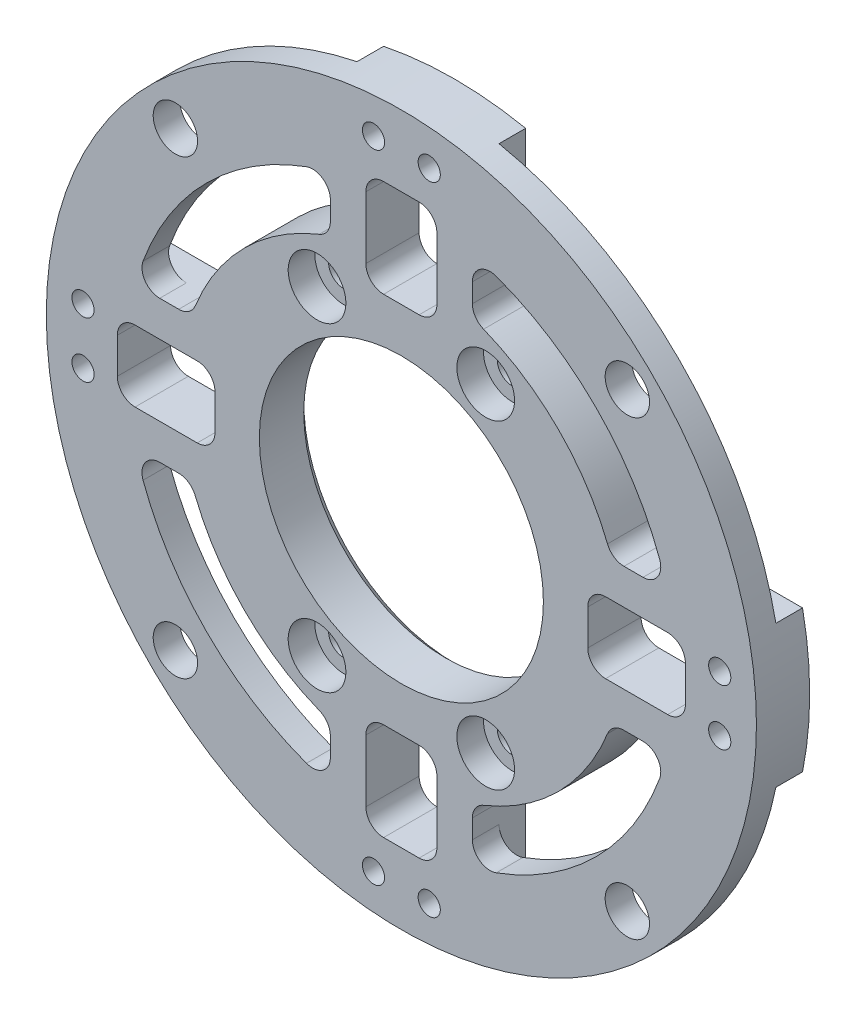
from build123d import *

# Parameters (mm, degrees)
SKETCH2_R             = 40
SKETCH2_R_2           = 16
BOSS_EXTRUDE1_DEPTH   = 6
CUT_EXTRUDE1_DEPTH    = 3
M3X0_5_TAPPED_HOLE1_D = 2.5
CIRPATTERN1_COUNT     = 4
CHAMFER1_SIZE         = 1
HOLE1_D               = 3.4
HOLE1_CBORE_D         = 6.5
HOLE1_CBORE_DEPTH     = 3
CUT_EXTRUDE2_DEPTH    = 57.648036153
SKETCH11_W            = 8
SKETCH11_H            = 11
CUT_EXTRUDE3_DEPTH    = 57.885850613
FILLET1_R             = 2
FILLET2_R             = 2
CIRPATTERN2_DEPTH     = 6
M4_CLEARANCE_HOLE1_D  = 5
CIRPATTERN3_COUNT     = 4
FILLET3_R             = 2


# Read off the part's stored shape, not the designer's step: CirPattern2
with BuildPart() as part:
    # Sketch2 → Boss-Extrude1 (new body)
    with BuildSketch(Plane.XY):
        Circle(SKETCH2_R)
        Circle(SKETCH2_R_2, mode=Mode.SUBTRACT)
    extrude(amount=BOSS_EXTRUDE1_DEPTH)

    # Sketch3 → Cut-Extrude1 (cut)
    with BuildSketch(Plane(origin=(0, 0, 0), x_dir=(-1, 0, 0), z_dir=(0, 0, -1))):
        with BuildLine():
            Line((-8, 23.685438565), (-8, 41.112910233))
            ThreePointArc((-8, 41.112910233), (-29.61647673, 29.61647673), (-41.112910233, 8))
            Line((-41.112910233, 8), (-23.685438565, 8))
            ThreePointArc((-23.685438565, 8), (-17.67766953, 17.67766953), (-8, 23.685438565))
        make_face()
        with BuildLine():
            ThreePointArc((41.112910233, 8), (29.61647673, 29.61647673), (8, 41.112910233))
            Line((8, 41.112910233), (8, 23.685438565))
            ThreePointArc((8, 23.685438565), (17.67766953, 17.67766953), (23.685438565, 8))
            Line((23.685438565, 8), (41.112910233, 8))
        make_face()
        with BuildLine():
            Line((-23.685438565, -8), (-41.112910233, -8))
            ThreePointArc((-41.112910233, -8), (-29.61647673, -29.61647673), (-8, -41.112910233))
            Line((-8, -41.112910233), (-8, -23.685438565))
            ThreePointArc((-8, -23.685438565), (-17.67766953, -17.67766953), (-23.685438565, -8))
        make_face()
        with BuildLine():
            ThreePointArc((8, -41.112910233), (29.61647673, -29.61647673), (41.112910233, -8))
            Line((41.112910233, -8), (23.685438565, -8))
            ThreePointArc((23.685438565, -8), (17.67766953, -17.67766953), (8, -23.685438565))
            Line((8, -23.685438565), (8, -41.112910233))
        make_face()
    extrude(amount=-CUT_EXTRUDE1_DEPTH, mode=Mode.SUBTRACT)

    # M3x0.5 Tapped Hole1 (through all)
    with Locations(Plane(origin=(0, 0, 0), x_dir=(-1, 0, 0), z_dir=(0, 0, -1))):
        with Locations((-3.137606739, 35.863009131), (3.137606739, 35.863009131)):
            m3x0_5_tapped_hole1 = Hole(M3X0_5_TAPPED_HOLE1_D / 2)

    # CirPattern1: M3x0.5 Tapped Hole1 ×4 about axis
    cirpattern1_axis = Axis((0, 0, 0), (0, 0, 1))
    for i in range(1, CIRPATTERN1_COUNT):
        add(m3x0_5_tapped_hole1.rotate(cirpattern1_axis, i * 360 / CIRPATTERN1_COUNT), mode=Mode.SUBTRACT)

    # Chamfer1
    chamfer1_edges = [part.edges().sort_by_distance(p)[0] for p in [
        (-16, 0, 0),
    ]]
    chamfer(chamfer1_edges, length=CHAMFER1_SIZE)

    # Hole1 (through all)
    with Locations(Plane.XY.offset(6)):
        with Locations((-9.5, 18), (9.5, 18), (-9.5, -18), (9.5, -18)):
            CounterBoreHole(HOLE1_D / 2, HOLE1_CBORE_D / 2, HOLE1_CBORE_DEPTH)

    # Sketch10 → Cut-Extrude2 (cut, through all)
    with BuildSketch(Plane(origin=(0, 0, 3), x_dir=(-1, 0, 0), z_dir=(0, 0, -1))):
        with BuildLine():
            Line((-29.949958264, 8), (-23.685438565, 8))
            ThreePointArc((-23.685438565, 8), (-17.67766953, 17.67766953), (-8, 23.685438565))
            Line((-8, 23.685438565), (-8, 29.949958264))
            ThreePointArc((-8, 29.949958264), (-21.920310217, 21.920310217), (-29.949958264, 8))
        make_face()
    extrude(amount=-CUT_EXTRUDE2_DEPTH, mode=Mode.SUBTRACT)

    # Sketch11 → Cut-Extrude3 (cut, through all)
    with BuildSketch(Plane(origin=(0, 0, 0), x_dir=(-1, 0, 0), z_dir=(0, 0, -1))):
        with Locations((0, 26.5)):
            Rectangle(SKETCH11_W, SKETCH11_H)
    extrude(amount=-CUT_EXTRUDE3_DEPTH, mode=Mode.SUBTRACT)

    # Fillet1
    fillet1_edges = [part.edges().sort_by_distance(p)[0] for p in [
        (4, 21, 3),
        (4, 32, 3),
        (-4, 32, 3),
        (-4, 21, 3),
    ]]
    fillet(fillet1_edges, radius=FILLET1_R)

    # Fillet2
    fillet2_edges = [part.edges().sort_by_distance(p)[0] for p in [
        (8, 29.949958264, 4.5),
        (29.949958264, 8, 4.5),
        (8, 23.685438565, 3),
        (23.685438565, 8, 3),
    ]]
    fillet(fillet2_edges, radius=FILLET2_R)

    # CirPattern2 outline → CirPattern2 (cut)
    with BuildSketch(Plane.XY):
        with BuildLine():
            Line((-27.221315178, 8), (-23.685438565, 8))
            ThreePointArc((-23.685438565, 8), (-17.67766953, 17.67766953), (-8, 23.685438565))
            Line((-8, 23.685438565), (-8, 27.221315178))
            ThreePointArc((-8, 27.221315178), (-8.855297057, 28.861331998), (-10.689655172, 29.098647259))
            ThreePointArc((-10.689655172, 29.098647259), (-21.920310217, 21.920310217), (-29.098647259, 10.689655172))
            ThreePointArc((-29.098647259, 10.689655172), (-28.861331998, 8.855297057), (-27.221315178, 8))
        make_face()
        with BuildLine():
            Line((-8, -27.221315178), (-8, -23.685438565))
            ThreePointArc((-8, -23.685438565), (-17.67766953, -17.67766953), (-23.685438565, -8))
            Line((-23.685438565, -8), (-27.221315178, -8))
            ThreePointArc((-27.221315178, -8), (-28.861331998, -8.855297057), (-29.098647259, -10.689655172))
            ThreePointArc((-29.098647259, -10.689655172), (-21.920310217, -21.920310217), (-10.689655172, -29.098647259))
            ThreePointArc((-10.689655172, -29.098647259), (-8.855297057, -28.861331998), (-8, -27.221315178))
        make_face()
        with BuildLine():
            Line((27.221315178, -8), (23.685438565, -8))
            ThreePointArc((23.685438565, -8), (17.67766953, -17.67766953), (8, -23.685438565))
            Line((8, -23.685438565), (8, -27.221315178))
            ThreePointArc((8, -27.221315178), (8.855297057, -28.861331998), (10.689655172, -29.098647259))
            ThreePointArc((10.689655172, -29.098647259), (21.920310217, -21.920310217), (29.098647259, -10.689655172))
            ThreePointArc((29.098647259, -10.689655172), (28.861331998, -8.855297057), (27.221315178, -8))
        make_face()
        with BuildLine():
            ThreePointArc((2, -32), (3.414213562, -31.414213562), (4, -30))
            Line((4, -30), (4, -23))
            ThreePointArc((4, -23), (3.414213562, -21.585786438), (2, -21))
            Line((2, -21), (-2, -21))
            ThreePointArc((-2, -21), (-3.414213562, -21.585786438), (-4, -23))
            Line((-4, -23), (-4, -30))
            ThreePointArc((-4, -30), (-3.414213562, -31.414213562), (-2, -32))
            Line((-2, -32), (2, -32))
        make_face()
        with BuildLine():
            ThreePointArc((-21, 2), (-21.585786438, 3.414213562), (-23, 4))
            Line((-23, 4), (-30, 4))
            ThreePointArc((-30, 4), (-31.414213562, 3.414213562), (-32, 2))
            Line((-32, 2), (-32, -2))
            ThreePointArc((-32, -2), (-31.414213562, -3.414213562), (-30, -4))
            Line((-30, -4), (-23, -4))
            ThreePointArc((-23, -4), (-21.585786438, -3.414213562), (-21, -2))
            Line((-21, -2), (-21, 2))
        make_face()
        with BuildLine():
            ThreePointArc((32, 2), (31.414213562, 3.414213562), (30, 4))
            Line((30, 4), (23, 4))
            ThreePointArc((23, 4), (21.585786438, 3.414213562), (21, 2))
            Line((21, 2), (21, -2))
            ThreePointArc((21, -2), (21.585786438, -3.414213562), (23, -4))
            Line((23, -4), (30, -4))
            ThreePointArc((30, -4), (31.414213562, -3.414213562), (32, -2))
            Line((32, -2), (32, 2))
        make_face()
    extrude(amount=CIRPATTERN2_DEPTH, mode=Mode.SUBTRACT)

    # M4 Clearance Hole1 (through all)
    with Locations(Plane.XY.offset(6)):
        with Locations((-25.455844123, 25.455844123)):
            m4_clearance_hole1 = Hole(M4_CLEARANCE_HOLE1_D / 2)

    # CirPattern3: M4 Clearance Hole1 ×4 about axis
    cirpattern3_axis = Axis((0, 0, 0), (0, 0, 1))
    for i in range(1, CIRPATTERN3_COUNT):
        add(m4_clearance_hole1.rotate(cirpattern3_axis, i * 360 / CIRPATTERN3_COUNT), mode=Mode.SUBTRACT)

    # Fillet3
    fillet3_edges = [part.edges().sort_by_distance(p)[0] for p in [
        (23.685438565, -8, 1.5),
        (8, -23.685438565, 1.5),
        (-8, -23.685438565, 1.5),
        (-23.685438565, -8, 1.5),
        (-23.685438565, 8, 1.5),
        (-8, 23.685438565, 1.5),
    ]]
    fillet(fillet3_edges, radius=FILLET3_R)


solid = part.part
